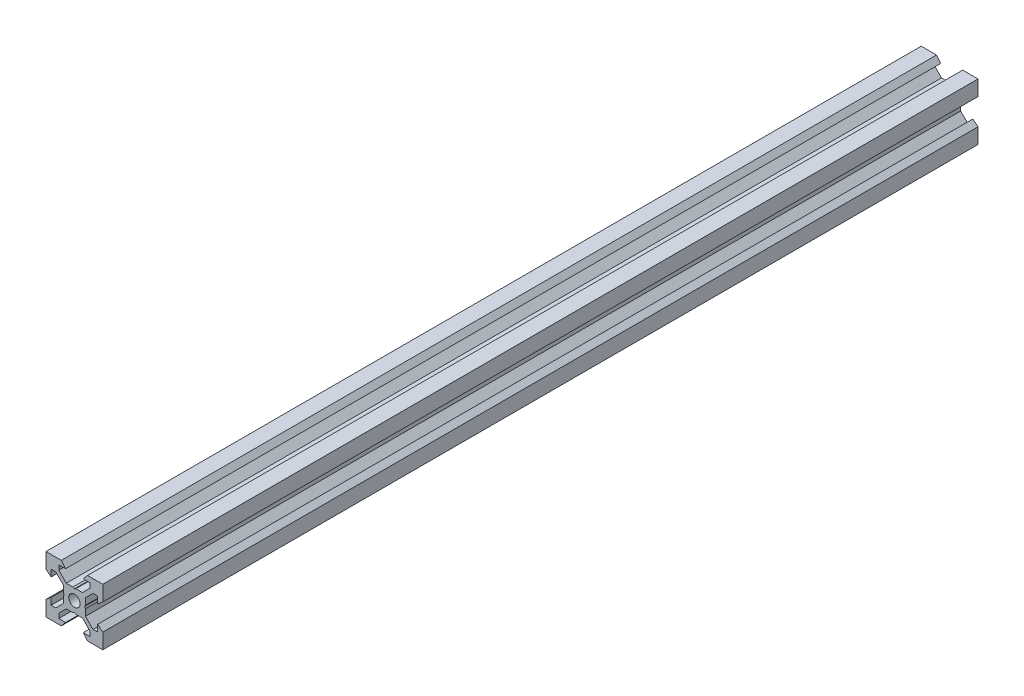
from build123d import *

# Parameters (mm, degrees)
SKETCH1_R           = 2
BOSS_EXTRUDE1_DEPTH = 154.165


with BuildPart() as part:
    # Sketch1 → Boss-Extrude1 (new, symmetric)
    with BuildSketch(Plane.XY):
        Polygon((10, 4.610379336), (10, 10), (4.610379336, 10), (3.1, 8.2), (5.5, 8.2), (5.5, 6.560660172), (2.839339828, 3.9), (0.519615242, 3.9), (0, 3.6), (-0.519615242, 3.9), (-2.839339828, 3.9), (-5.5, 6.560660172), (-5.5, 8.2), (-3.1, 8.2), (-4.610379336, 10), (-10, 10), (-10, 4.610379336), (-8.2, 3.1), (-8.2, 5.5), (-6.560660172, 5.5), (-3.9, 2.839339828), (-3.9, 0.519615242), (-3.6, 0), (-3.9, -0.519615242), (-3.9, -2.839339828), (-6.560660172, -5.5), (-8.2, -5.5), (-8.2, -3.1), (-10, -4.610379336), (-10, -10), (-4.610379336, -10), (-3.1, -8.2), (-5.5, -8.2), (-5.5, -6.560660172), (-2.839339828, -3.9), (-0.519615242, -3.9), (0, -3.6), (0.519615242, -3.9), (2.839339828, -3.9), (5.5, -6.560660172), (5.5, -8.2), (3.1, -8.2), (4.610379336, -10), (10, -10), (10, -4.610379336), (8.2, -3.1), (8.2, -5.5), (6.560660172, -5.5), (3.9, -2.839339828), (3.9, -0.519615242), (3.6, 0), (3.9, 0.519615242), (3.9, 2.839339828), (6.560660172, 5.5), (8.2, 5.5), (8.2, 3.1), align=None)
        Circle(SKETCH1_R, mode=Mode.SUBTRACT)
    extrude(amount=BOSS_EXTRUDE1_DEPTH, both=True)


solid = part.part
